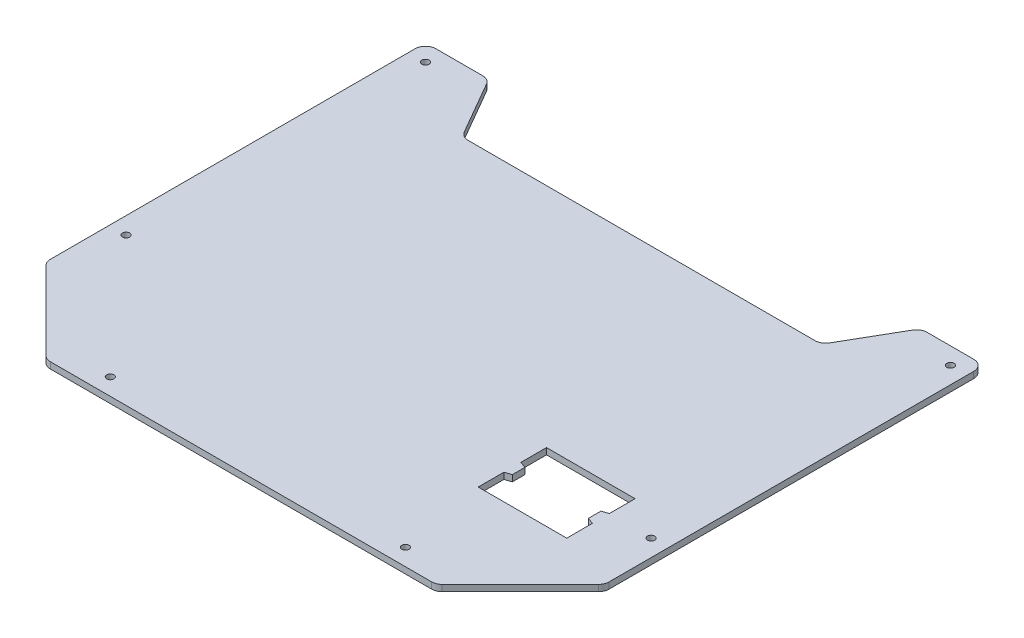
from build123d import *

# Parameters (mm, degrees)
BOSS_EXTRU_1_DEPTH      = 3
CONG_1_R                = 5
ESQUISSE2_R             = 1
ENL_V_MAT_EXTRU_1_DEPTH = 257.837010573
D_GAGEMENT_M31_D        = 3.4
ENL_V_MAT_EXTRU_2_DEPTH = 257.837010573


with BuildPart() as part:
    # Esquisse1 → Boss.-Extru.1 (new body)
    with BuildSketch(Plane(origin=(0, 0, 0), x_dir=(1, 0, 0), z_dir=(0, 1, 0))):
        Polygon((-92.5, 0), (92.5, 0), (132.5, 40), (132.5, 220), (102.5, 220), (85.179491924, 190), (-85.179491924, 190), (-102.5, 220), (-132.5, 220), (-132.5, 40), align=None)
    extrude(amount=BOSS_EXTRU_1_DEPTH)

    # Congé1
    cong_1_edges = [part.edges().sort_by_distance(p)[0] for p in [
        (132.5, 1.5, -220),
        (102.5, 1.5, -220),
        (85.179491924, 1.5, -190),
        (-85.179491924, 1.5, -190),
        (-102.5, 1.5, -220),
        (-132.5, 1.5, -220),
        (-132.5, 1.5, -40),
        (-92.5, 1.5, 0),
        (92.5, 1.5, 0),
        (132.5, 1.5, -40),
    ]]
    fillet(cong_1_edges, radius=CONG_1_R)

    # Esquisse2 → Enlèv. mat.-Extru.1 (cut, through all)
    with BuildSketch(Plane.XZ):
        with Locations((-70, -8)):
            Circle(ESQUISSE2_R)
        with Locations((-124.5, -70)):
            Circle(ESQUISSE2_R)
        with Locations((-124.5, -212)):
            Circle(ESQUISSE2_R)
        with Locations((124.5, -212)):
            Circle(ESQUISSE2_R)
        with Locations((124.5, -70)):
            Circle(ESQUISSE2_R)
        with Locations((70, -8)):
            Circle(ESQUISSE2_R)
    extrude(amount=-ENL_V_MAT_EXTRU_1_DEPTH, mode=Mode.SUBTRACT)

    # Dégagement M31 (through all)
    with Locations(Plane(origin=(0, 0, 0), x_dir=(-1, 0, 0), z_dir=(0, -1, 0))):
        with Locations((-70, 8), (-124.5, 70), (-124.5, 212), (124.5, 212), (124.5, 70), (70, 8)):
            Hole(D_GAGEMENT_M31_D / 2)

    # Esquisse5 → Enlèv. mat.-Extru.2 (cut, through all)
    with BuildSketch(Plane.XZ):
        Polygon((104.5, -50), (62.5, -50), (62.5, -62.2), (65.5, -63.2), (65.5, -69.2), (62.5, -70.2), (62.5, -82.4), (104.5, -82.4), (104.5, -70.2), (101.5, -69.2), (101.5, -63.2), (104.5, -62.2), align=None)
    extrude(amount=-ENL_V_MAT_EXTRU_2_DEPTH, mode=Mode.SUBTRACT)


solid = part.part
